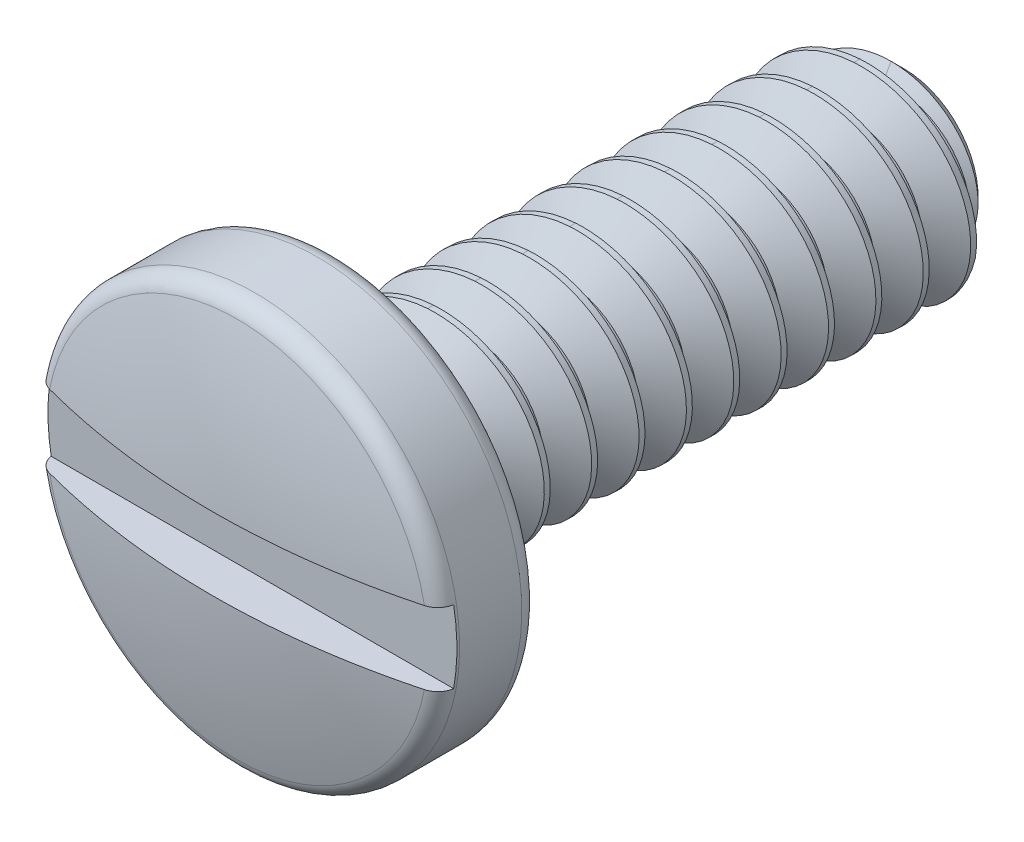
from build123d import *

# Parameters (mm, degrees)
SKETCH3_W               = 9.525
SKETCH3_H               = 1.237044252
SWEEP1_PITCH            = 0.79375
SWEEP2_PITCH            = 0.79375
SKETCH10_W              = 254
SKETCH10_H              = 12.7
SKETCH8_W               = 2.0828
SKETCH8_H               = 3.429
SKETCH12_W              = 6.858
SKETCH12_H              = 1.2192
CUT_EXTRUDE_THIN2_DEPTH = 0.6858


with BuildPart() as part:
    # Sketch3 → Revolve1 (revolve)
    with BuildSketch(Plane(origin=(0, 0, 0), x_dir=(0, 0, -1), z_dir=(1, 0, 0)), mode=Mode.PRIVATE) as revolve1_sk:
        with Locations((-4.7625, 0.618522126)):
            Rectangle(SKETCH3_W, SKETCH3_H)
    revolve(revolve1_sk.sketch.rotate(Axis((0, 0, 0), (0, 0, -1)), 90), axis=Axis((0, 0, 0), (0, 0, -1)))

    # Sweep1: the profile of Sketch2 profile screwed along a right-hand helix of 13 turns, 6 arcs to a turn; built about Z, then put on its axis
    sweep1_z = Axis((0, 0, 0), (0, 0, 1))
    sweep1_corners = [(1.7526, 0, 0.049609375), (1.7526, 0, -0.049609375), (1.236744252, 0, -0.34743883), (1.236744252, 0, 0.34743883)]
    with BuildLine(mode=Mode.PRIVATE) as sweep1_profile:
        Line(sweep1_corners[0], sweep1_corners[1])
        Line(sweep1_corners[1], sweep1_corners[2])
        Line(sweep1_corners[2], sweep1_corners[3])
        Line(sweep1_corners[3], sweep1_corners[0])
    sweep1_cap = Face(sweep1_profile.wire())
    sweep1_turn_angles = [0, 30, 60, 90, 120, 150, 180, 210, 240, 270, 300, 330, 360]
    sweep1_turn_weights = [1, 0.8660254037844387, 1, 0.8660254037844387, 1, 0.8660254037844387, 1, 0.8660254037844387, 1, 0.8660254037844387, 1, 0.8660254037844387, 1]
    sweep1_turn_rails = [Edge.make_bspline([Vector(p[0], p[1], 0).rotate(sweep1_z, sweep1_turn_angles[k]) / sweep1_turn_weights[k] + Vector(0, 0, p[2] + SWEEP1_PITCH * sweep1_turn_angles[k] / 360) for k in range(13)], [0, 0, 0, 1, 1, 2, 2, 3, 3, 4, 4, 5, 5, 6, 6, 6], 2, sweep1_turn_weights) for p in sweep1_corners]
    sweep1_turn_sides = [Face.make_surface_from_curves(sweep1_turn_rails[p[0]], sweep1_turn_rails[p[1]]) for p in [(0, 1), (1, 2), (2, 3), (3, 0)]]
    sweep1 = Plane(origin=(0, 0, 0), x_dir=(0, 1, 0), z_dir=(0, 0, 1)) * Solid(Shell([*[p.moved(Location((0, 0, SWEEP1_PITCH * i))) for i in range(13) for p in sweep1_turn_sides], sweep1_cap, sweep1_cap.rotate(sweep1_z, 4680).moved(Location((0, 0, SWEEP1_PITCH * 4680 / 360)))]))
    add(sweep1)

    # Sweep2: the profile of Sketch6 screwed along a right-hand helix of 1 turns, 6 arcs to a turn; built about Z, then put on its axis
    sweep2_z = Axis((0, 0, 0), (0, 0, 1))
    sweep2_corners = [(1.7526, 0, -0.049609375), (1.237044252, 0, -0.347265625), (1.237044252, 0, 0), (1.237044252, 0, 0.347265625), (1.7526, 0, 0.049609375)]
    with BuildLine(mode=Mode.PRIVATE) as sweep2_profile:
        Line(sweep2_corners[0], sweep2_corners[1])
        Line(sweep2_corners[1], sweep2_corners[2])
        Line(sweep2_corners[2], sweep2_corners[3])
        Line(sweep2_corners[3], sweep2_corners[4])
        Line(sweep2_corners[4], sweep2_corners[0])
    sweep2_cap = Face(sweep2_profile.wire())
    sweep2_turn_angles = [0, 30, 60, 90, 120, 150, 180, 210, 240, 270, 300, 330, 360]
    sweep2_turn_weights = [1, 0.8660254037844387, 1, 0.8660254037844387, 1, 0.8660254037844387, 1, 0.8660254037844387, 1, 0.8660254037844387, 1, 0.8660254037844387, 1]
    sweep2_turn_rails = [Edge.make_bspline([Vector(p[0], p[1], 0).rotate(sweep2_z, sweep2_turn_angles[k]) / sweep2_turn_weights[k] + Vector(0, 0, p[2] + SWEEP2_PITCH * sweep2_turn_angles[k] / 360) for k in range(13)], [0, 0, 0, 1, 1, 2, 2, 3, 3, 4, 4, 5, 5, 6, 6, 6], 2, sweep2_turn_weights) for p in sweep2_corners]
    sweep2_turn_sides = [Face.make_surface_from_curves(sweep2_turn_rails[p[0]], sweep2_turn_rails[p[1]]) for p in [(0, 1), (1, 2), (2, 3), (3, 4), (4, 0)]]
    sweep2 = Plane(origin=(0, 0, 0), x_dir=(0, 1, 0), z_dir=(0, 0, -1)) * Solid(Shell([*sweep2_turn_sides, sweep2_cap, sweep2_cap.rotate(sweep2_z, 360).moved(Location((0, 0, SWEEP2_PITCH * 360 / 360)))]))
    add(sweep2)

    # Sketch4 → Cut-Revolve1 (revolve, cut)
    with BuildSketch(Plane(origin=(0, 0, 0), x_dir=(0, 0, -1), z_dir=(1, 0, 0))):
        Polygon((0, 1.237044252), (-3.175, 4.412044252), (2.54, 4.412044252), (2.54, 0), (0, 0), align=None)
    revolve(axis=Axis((0, 0, -2.54), (0, 0, -1)), mode=Mode.SUBTRACT)

    # Sketch10 → Cut-Revolve2 (revolve, cut)
    with BuildSketch(Plane(origin=(0, 0, 0), x_dir=(0, 0, -1), z_dir=(1, 0, 0))):
        with Locations((-136.525, 6.35)):
            Rectangle(SKETCH10_W, SKETCH10_H)
    revolve(axis=Axis((0, 0, 0), (0, 0, -1)), mode=Mode.SUBTRACT)

    # Sketch8 → Revolve2 (revolve)
    with BuildSketch(Plane(origin=(0, 0, 0), x_dir=(0, 0, -1), z_dir=(1, 0, 0)), mode=Mode.PRIVATE) as revolve2_sk:
        with Locations((-10.5664, 1.7145)):
            Rectangle(SKETCH8_W, SKETCH8_H)
    revolve(revolve2_sk.sketch.rotate(Axis((0, 0, 0), (0, 0, 1)), 90), axis=Axis((0, 0, 0), (0, 0, 1)))

    # Sketch11 → Cut-Revolve3 (revolve, cut)
    with BuildSketch(Plane(origin=(0, 0, 0), x_dir=(0, 0, -1), z_dir=(1, 0, 0)), mode=Mode.PRIVATE) as cut_revolve3_sk:
        with BuildLine():
            Line((-10.87882, 3.429), (-9.83742, 3.429))
            ThreePointArc((-9.83742, 3.429), (-9.616505699, 3.337494301), (-9.525, 3.11658))
            Line((-9.525, 3.11658), (-8.89, 3.11658))
            Line((-8.89, 3.11658), (-8.89, 4.064))
            Line((-8.89, 4.064), (-12.2428, 4.064))
            Line((-12.2428, 4.064), (-12.2428, 0))
            Line((-12.2428, 0), (-11.6078, 0))
            ThreePointArc((-11.6078, 0), (-11.500445178, 1.61353744), (-11.180273266, 3.198629891))
            ThreePointArc((-11.180273266, 3.198629891), (-11.068520065, 3.364814046), (-10.87882, 3.429))
        make_face()
    revolve(cut_revolve3_sk.sketch.rotate(Axis((0, 0, 11.6078), (0, 0, -1)), 180), axis=Axis((0, 0, 11.6078), (0, 0, -1)), mode=Mode.SUBTRACT)

    # Sketch12 → Cut-Extrude-Thin2 (cut)
    with BuildSketch(Plane.XY.offset(11.6078)):
        Rectangle(SKETCH12_W, SKETCH12_H)
    extrude(amount=-CUT_EXTRUDE_THIN2_DEPTH, mode=Mode.SUBTRACT)


solid = part.part
